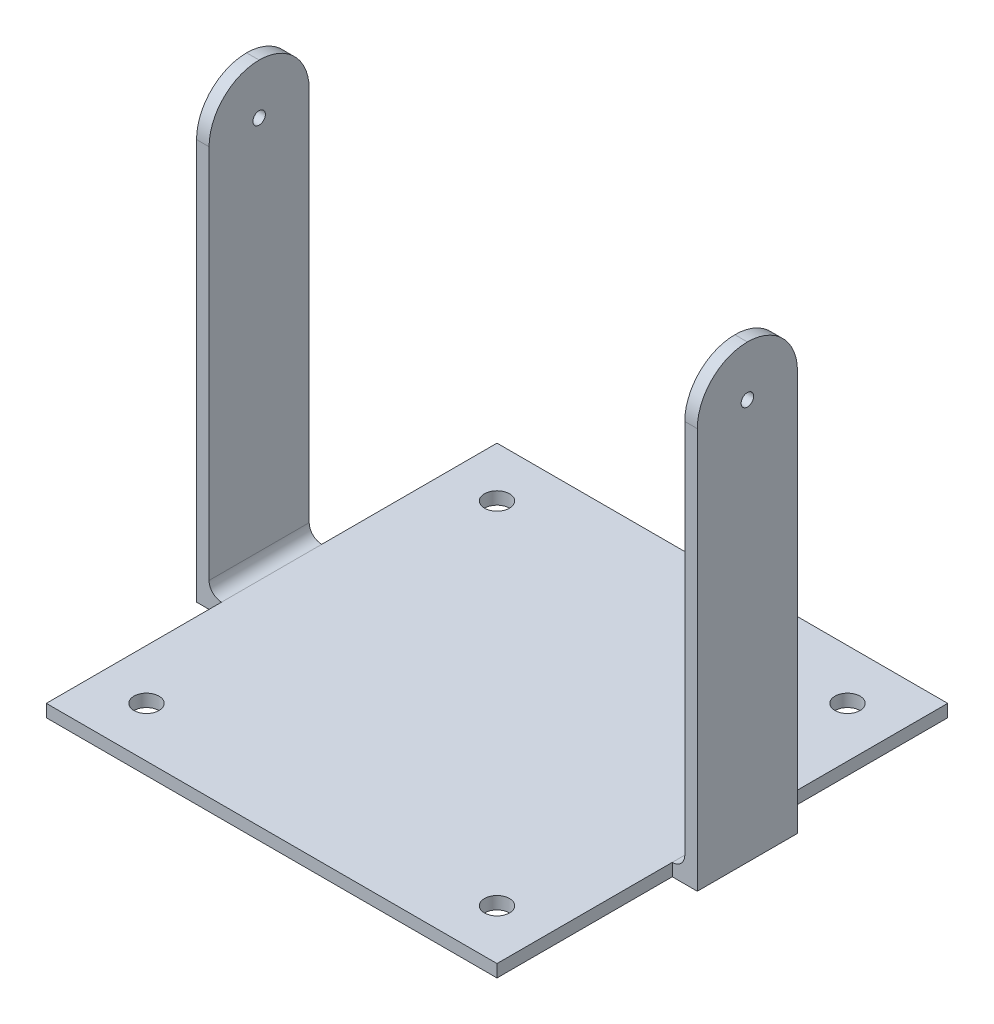
from build123d import *

# Parameters (mm, degrees)
SKETCH1_W            = 228.6
SKETCH1_H            = 457.2
BOSS_EXTRUDE1_DEPTH  = 12.7
SKETCH2_W            = 12.7
SKETCH2_H            = 101.6
BOSS_EXTRUDE2_DEPTH  = 12.7
SKETCH3_W            = 101.6
SKETCH3_H            = 457.2
BOSS_EXTRUDE3_DEPTH  = 12.7
FILLET1_R            = 12.7
FILLET1_OF_MIRROR1_R = 12.7
SKETCH4_R            = 6.35
CUT_EXTRUDE1_DEPTH   = 823.269834057
FILLET2_R            = 50.8
FILLET3_R            = 50.8
FILLET4_R            = 50.8
FILLET5_R            = 50.8
SKETCH5_R            = 12.7
CUT_EXTRUDE2_DEPTH   = 687.387711137
SKETCH6_R            = 12.7
CUT_EXTRUDE3_DEPTH   = 687.387711137


with BuildPart() as part:
    # Sketch1 → Boss-Extrude1 (new body)
    with BuildSketch(Plane(origin=(0, 0, 0), x_dir=(1, 0, 0), z_dir=(0, 1, 0))):
        with Locations((114.3, 228.6)):
            Rectangle(SKETCH1_W, SKETCH1_H)
    boss_extrude1 = extrude(amount=BOSS_EXTRUDE1_DEPTH)

    # Sketch2 → Boss-Extrude2 (add)
    with BuildSketch(Plane(origin=(0, 12.7, 0), x_dir=(1, 0, 0), z_dir=(0, 1, 0))):
        with Locations((234.95, 228.6)):
            Rectangle(SKETCH2_W, SKETCH2_H)
    boss_extrude2 = extrude(amount=-BOSS_EXTRUDE2_DEPTH)

    # Sketch3 → Boss-Extrude3 (add)
    with BuildSketch(Plane(origin=(241.3, 0, 0), x_dir=(0, 0, -1), z_dir=(1, 0, 0))):
        with Locations((228.6, 228.6)):
            Rectangle(SKETCH3_W, SKETCH3_H)
    boss_extrude3 = extrude(amount=BOSS_EXTRUDE3_DEPTH)

    # Fillet1
    fillet1_edges = [part.edges().sort_by_distance(p)[0] for p in [
        (241.3, 12.7, -228.6),
    ]]
    fillet(fillet1_edges, radius=FILLET1_R)

    # Mirror1: Boss-Extrude1, Boss-Extrude2, Boss-Extrude3 across plane
    add(boss_extrude1.mirror(Plane(origin=(0, 12.7, 0), x_dir=(0, 0, 1), z_dir=(1, 0, 0))))
    add(boss_extrude2.mirror(Plane(origin=(0, 12.7, 0), x_dir=(0, 0, 1), z_dir=(1, 0, 0))))
    add(boss_extrude3.mirror(Plane(origin=(0, 12.7, 0), x_dir=(0, 0, 1), z_dir=(1, 0, 0))))

    # Fillet1 of Mirror1
    fillet1_of_mirror1_edges = [part.edges().sort_by_distance(p)[0] for p in [
        (-241.3, 12.7, -228.6),
    ]]
    fillet(fillet1_of_mirror1_edges, radius=FILLET1_OF_MIRROR1_R)

    # Sketch4 → Cut-Extrude1 (cut, through all)
    with BuildSketch(Plane.ZY.offset(254)):
        with Locations((-228.6, 406.4)):
            Circle(SKETCH4_R)
    extrude(amount=-CUT_EXTRUDE1_DEPTH, mode=Mode.SUBTRACT)

    # Fillet2
    fillet2_edges = [part.edges().sort_by_distance(p)[0] for p in [
        (-247.65, 457.2, -177.8),
    ]]
    fillet(fillet2_edges, radius=FILLET2_R)

    # Fillet3
    fillet3_edges = [part.edges().sort_by_distance(p)[0] for p in [
        (-247.65, 457.2, -279.4),
    ]]
    fillet(fillet3_edges, radius=FILLET3_R - 0.0001)  # a hair under: the kernel refuses the full size

    # Fillet4
    fillet4_edges = [part.edges().sort_by_distance(p)[0] for p in [
        (247.65, 457.2, -177.8),
    ]]
    fillet(fillet4_edges, radius=FILLET4_R)

    # Fillet5
    fillet5_edges = [part.edges().sort_by_distance(p)[0] for p in [
        (247.65, 457.2, -279.4),
    ]]
    fillet(fillet5_edges, radius=FILLET5_R - 0.0001)  # a hair under: the kernel refuses the full size

    # Sketch5 → Cut-Extrude2 (cut, through all)
    with BuildSketch(Plane(origin=(0, 12.7, 0), x_dir=(1, 0, 0), z_dir=(0, 1, 0))):
        with Locations(Location((-177.8, 406.4, 0), (0, 0, 270))):
            Circle(SKETCH5_R)
    extrude(amount=-CUT_EXTRUDE2_DEPTH, mode=Mode.SUBTRACT)

    # Sketch6 → Cut-Extrude3 (cut, through all)
    with BuildSketch(Plane(origin=(0, 12.7, 0), x_dir=(1, 0, 0), z_dir=(0, 1, 0))):
        with Locations(Location((177.8, 406.4, 0), (0, 0, 270))):
            Circle(SKETCH6_R)
        with Locations(Location((-177.8, 50.8, 0), (0, 0, 270))):
            Circle(SKETCH6_R)
        with Locations(Location((177.8, 50.8, 0), (0, 0, 270))):
            Circle(SKETCH6_R)
    extrude(amount=-CUT_EXTRUDE3_DEPTH, mode=Mode.SUBTRACT)


solid = part.part
